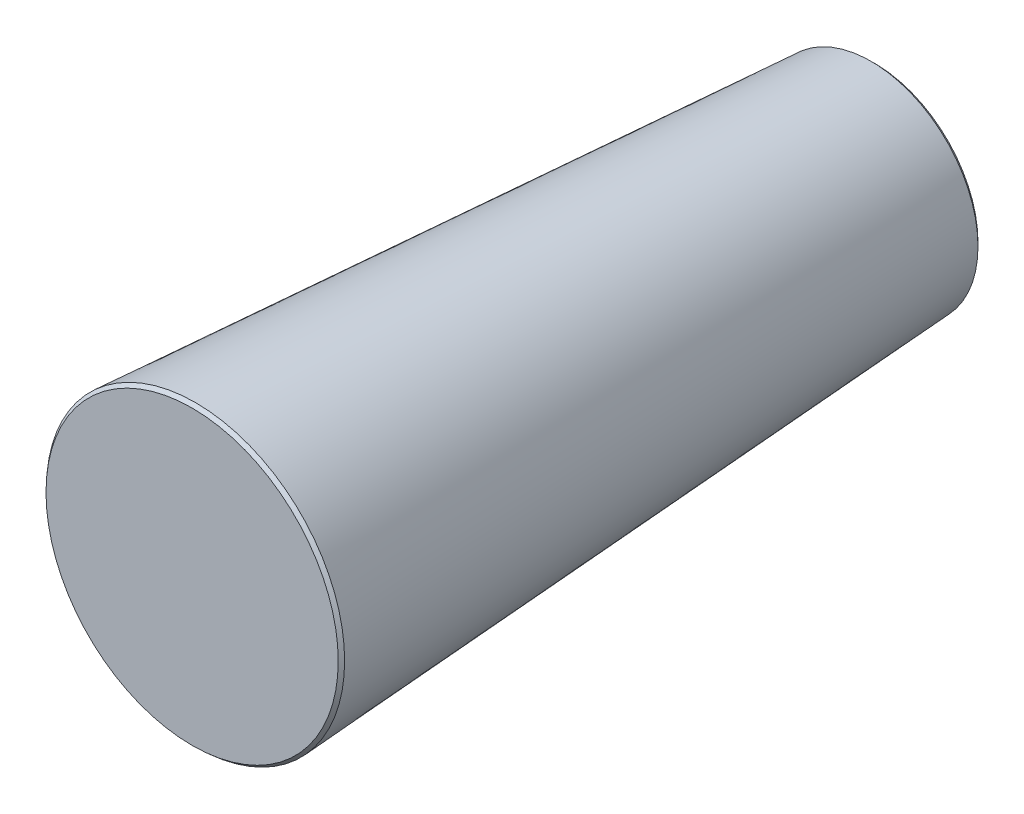
from build123d import *
from OCP.BRepFilletAPI import BRepFilletAPI_MakeChamfer

# Parameters (mm, degrees)
CHAMFER1_SIZE    = 0.254
CHAMFER1_SIZE2   = 0.271461984
CHAMFER1_SIZE2_2 = 0.23952528


# Read off the part's stored shape, not the designer's step: Sweep1
with BuildPart() as part:
    # Sweep1 outline → Sweep1 (revolve)
    with BuildSketch(Plane.XZ):
        Polygon((0, 50.8), (0, 0), (7.9375, 0), (11.1125, 50.8), align=None)
    revolve(axis=Axis((0, 0, 0), (0, 0, 1)))

    # Chamfer1: one chamfer whose edges measure the first distance from different faces: ONE call of the kernel's chamfer builder (chamfer() names one face for all edges)
    chamfer1_edges_1 = [part.edges().sort_by_distance(p)[0] for p in [
        (-7.9375, 0, 0),
    ]]
    chamfer1_side_1 = [part.faces().sort_by_distance(p)[0] for p in [
        (0, 0, 0),
    ]]
    chamfer1_edges_2 = [part.edges().sort_by_distance(p)[0] for p in [
        (-11.1125, 0, 50.8),
    ]]
    chamfer1_side_2 = [part.faces().sort_by_distance(p)[0] for p in [
        (-9.525, 0, 25.4),
    ]]
    chamfer1 = BRepFilletAPI_MakeChamfer(part.part.solid().wrapped)
    for e in chamfer1_edges_1:
        chamfer1.Add(CHAMFER1_SIZE, CHAMFER1_SIZE2, e.wrapped, chamfer1_side_1[0].wrapped)  # the first distance lies on this face
    for e in chamfer1_edges_2:
        chamfer1.Add(CHAMFER1_SIZE, CHAMFER1_SIZE2_2, e.wrapped, chamfer1_side_2[0].wrapped)  # the first distance lies on this face
    add(Compound.cast(chamfer1.Shape()), mode=Mode.REPLACE)


solid = part.part
